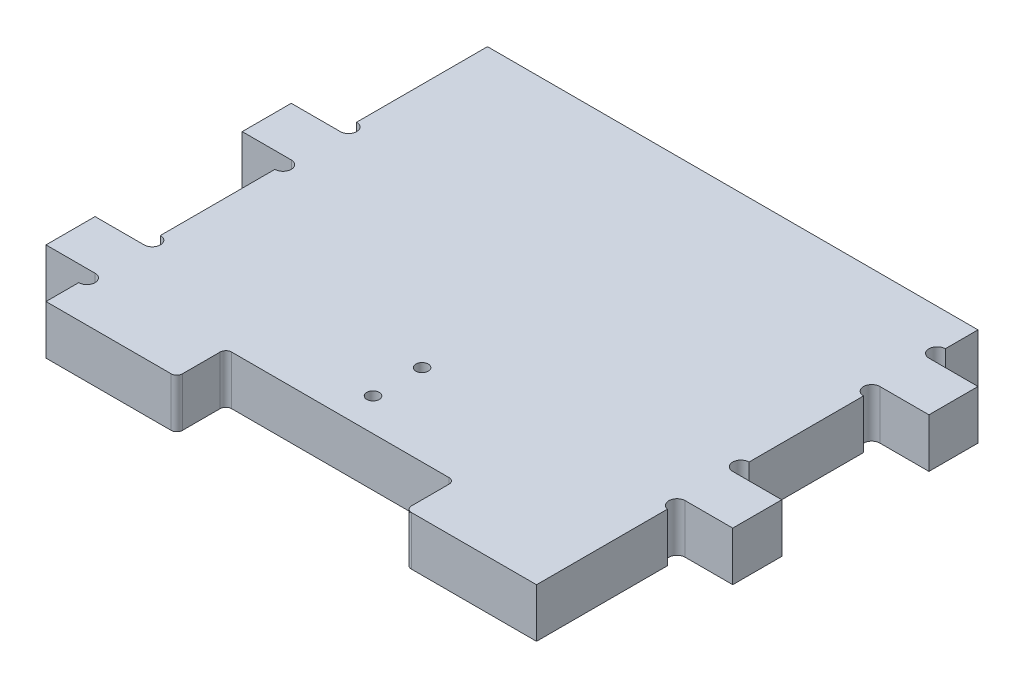
from build123d import *

# Parameters (mm, degrees)
BOSS_EXTRUDE1_DEPTH = 19.05
FILLET1_R           = 2.2225
SKETCH2_R           = 2.413
CUT_EXTRUDE1_DEPTH  = 272.420720469


with BuildPart() as part:
    # Sketch1 → Boss-Extrude1 (new body)
    with BuildSketch(Plane(origin=(0, 0, 0), x_dir=(1, 0, 0), z_dir=(0, 1, 0))):
        with BuildLine():
            Line((190.5, 171.45), (0, 171.45))
            Line((0, 171.45), (0, 120.65))
            ThreePointArc((0, 120.65), (3.175, 117.475), (0, 114.3))
            Line((0, 114.3), (-19.05, 114.3))
            Line((-19.05, 114.3), (-19.05, 95.25))
            Line((-19.05, 95.25), (0, 95.25))
            ThreePointArc((0, 95.25), (3.175, 92.075), (0, 88.9))
            Line((0, 88.9), (0, 44.45))
            ThreePointArc((0, 44.45), (3.175, 41.275), (0, 38.1))
            Line((0, 38.1), (-19.05, 38.1))
            Line((-19.05, 38.1), (-19.05, 19.05))
            Line((-19.05, 19.05), (0, 19.05))
            ThreePointArc((0, 19.05), (3.175, 15.875), (0, 12.7))
            Line((0, 12.7), (0, 0))
            Line((0, 0), (50.8, 0))
            Line((50.8, 0), (50.8, 19.05))
            Line((50.8, 19.05), (139.7, 19.05))
            Line((139.7, 19.05), (139.7, 0))
            Line((139.7, 0), (190.5, 0))
            Line((190.5, 0), (190.5, 50.855736572))
            ThreePointArc((190.5, 50.855736572), (187.931266017, 54.272458919), (191.092301163, 57.15))
            Line((191.092301163, 57.15), (209.55, 57.15))
            Line((209.55, 57.15), (209.55, 76.2))
            Line((209.55, 76.2), (190.5, 76.2))
            ThreePointArc((190.5, 76.2), (187.325, 79.375), (190.5, 82.55))
            Line((190.5, 82.55), (190.5, 127))
            ThreePointArc((190.5, 127), (187.325, 130.175), (190.5, 133.35))
            Line((190.5, 133.35), (209.55, 133.35))
            Line((209.55, 133.35), (209.55, 152.4))
            Line((209.55, 152.4), (190.5, 152.4))
            ThreePointArc((190.5, 152.4), (187.325, 155.575), (190.5, 158.75))
            Line((190.5, 158.75), (190.5, 171.45))
        make_face()
    extrude(amount=BOSS_EXTRUDE1_DEPTH)

    # Fillet1
    fillet1_edges = [part.edges().sort_by_distance(p)[0] for p in [
        (139.7, 9.525, 0),
        (139.7, 9.525, -19.05),
        (50.8, 9.525, -19.05),
        (50.8, 9.525, 0),
    ]]
    fillet(fillet1_edges, radius=FILLET1_R)

    # Sketch2 → Cut-Extrude1 (cut, through all)
    with BuildSketch(Plane.XZ):
        with Locations((95.25, -31.75)):
            Circle(SKETCH2_R)
        with Locations((95.25, -50.8)):
            Circle(SKETCH2_R)
    extrude(amount=-CUT_EXTRUDE1_DEPTH, mode=Mode.SUBTRACT)


solid = part.part
